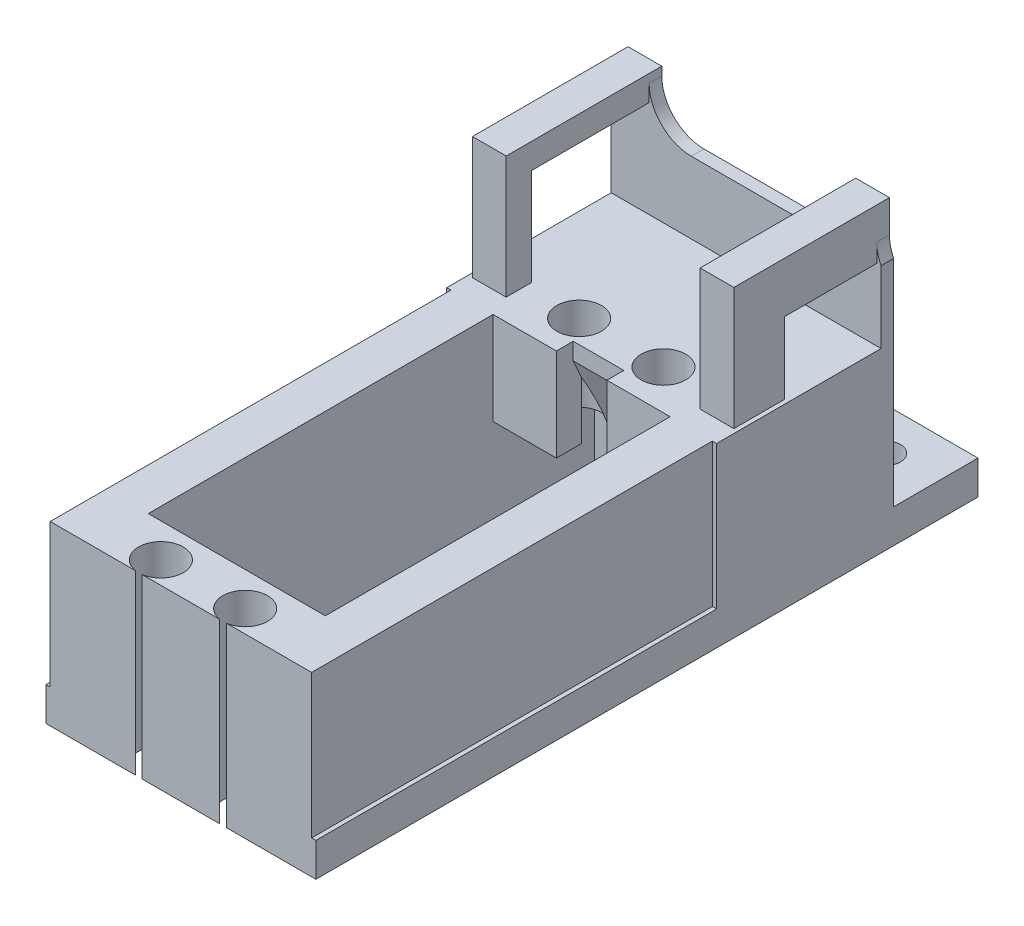
from build123d import *

# Parameters (mm, degrees)
SKETCH1_W                  = 32
SKETCH1_H                  = 78.52
BOSS_EXTRUDE1_DEPTH        = 4
M3_CLEARANCE_HOLE1_D       = 3.6
M3_CLEARANCE_HOLE1_DEPTH   = 10
M3_CLEARANCE_HOLE1_TIP     = 1.081549114
BOSS_EXTRUDE2_DEPTH        = 17
BOSS_EXTRUDE3_DEPTH        = 17
SKETCH6_W                  = 32
SKETCH6_H                  = 1.5
SKETCH6_W_2                = 4
SKETCH6_H_2                = 6
BOSS_EXTRUDE4_DEPTH        = 8.5
SKETCH14_W                 = 4
SKETCH14_H                 = 18.45
BOSS_EXTRUDE5_DEPTH        = 6
FILLET1_R                  = 5
CHAMFER1_SIZE              = 3
CHAMFER2_SIZE              = 3
CUT_EXTRUDE1_DEPTH         = 87.102499383
CUT_EXTRUDE1_DEPTH_BACK    = 87.102499383
SKETCH15_W                 = 21
SKETCH15_H                 = 40.897809358
F_5_3_5_3_DIAMETER_HOLE1_D = 5.3
SKETCH19_W                 = 21
SKETCH19_H                 = 12
CUT_EXTRUDE2_DEPTH         = 10
CUT_EXTRUDE3_DEPTH         = 83.839546112
CUT_EXTRUDE3_DEPTH_BACK    = 83.839546112
SKETCH20_W                 = 6
SKETCH20_H                 = 2
CHAMFER3_SIZE              = 8.984147096
CHAMFER3_SIZE_2            = 4


with BuildPart() as part:
    # Sketch1 → Boss-Extrude1 (new body)
    with BuildSketch(Plane(origin=(0, 0, 0), x_dir=(1, 0, 0), z_dir=(0, 1, 0))):
        with Locations((0, 39.26)):
            Rectangle(SKETCH1_W, SKETCH1_H)
    extrude(amount=BOSS_EXTRUDE1_DEPTH)

    # M3 Clearance Hole1
    with Locations(Plane(origin=(0, 4, 0), x_dir=(1, 0, 0), z_dir=(0, 1, 0))):
        with Locations((-10, 73.52), (10, 73.52)):
            Hole(M3_CLEARANCE_HOLE1_D / 2, depth=M3_CLEARANCE_HOLE1_DEPTH)
            with Locations((0, 0, -(M3_CLEARANCE_HOLE1_DEPTH + M3_CLEARANCE_HOLE1_TIP / 2))):  # 118° drill point
                Cone(0, M3_CLEARANCE_HOLE1_D / 2, M3_CLEARANCE_HOLE1_TIP, mode=Mode.SUBTRACT)

    # Sketch5 → Boss-Extrude2 (add)
    with BuildSketch(Plane(origin=(0, 4, 0), x_dir=(1, 0, 0), z_dir=(0, 1, 0))):
        Polygon((16, 68.52), (-16, 68.52), (-16, 47.520000358), (-15.5, 47.520000358), (-10.5, 47.520000358), (10.5, 47.520000358), (15.5, 47.520000358), (16, 47.520000358), align=None)
    extrude(amount=BOSS_EXTRUDE2_DEPTH)

    # Sketch5<4> → Boss-Extrude3 (add)
    with BuildSketch(Plane(origin=(0, 4, 0), x_dir=(1, 0, 0), z_dir=(0, 1, 0))):
        Polygon((-10.5, 47.520000358), (-15.5, 47.520000358), (-15.5, 0), (15.5, 0), (15.5, 47.520000358), (10.5, 47.520000358), (10.5, 6.622191), (-10.5, 6.622191), align=None)
    extrude(amount=BOSS_EXTRUDE3_DEPTH)

    # Sketch6 → Boss-Extrude4 (add)
    with BuildSketch(Plane(origin=(0, 21, 0), x_dir=(1, 0, 0), z_dir=(0, 1, 0))):
        with Locations((0, 67.77)):
            Rectangle(SKETCH6_W, SKETCH6_H)
        with Locations((13.5, 53.07)):
            Rectangle(SKETCH6_W_2, SKETCH6_H_2)
        with Locations((-13.5, 53.07)):
            Rectangle(SKETCH6_W_2, SKETCH6_H_2)
    extrude(amount=BOSS_EXTRUDE4_DEPTH)

    # Sketch14 → Boss-Extrude5 (add)
    with BuildSketch(Plane(origin=(0, 29.5, 0), x_dir=(1, 0, 0), z_dir=(0, 1, 0))):
        with Locations((-13.5, 59.295)):
            Rectangle(SKETCH14_W, SKETCH14_H)
        with Locations((13.5, 59.295)):
            Rectangle(SKETCH14_W, SKETCH14_H)
    extrude(amount=BOSS_EXTRUDE5_DEPTH)

    # Fillet1
    # the kernel refuses this fillet: 5 mm, written as the material it adds along each edge
    with BuildSketch(Plane(origin=(-11.5, 29.5, -68.52), x_dir=(0, 1, 0), z_dir=(0, 0, 1)), Plane(origin=(11.5, 29.5, -68.52), x_dir=(-1, 0, 0), z_dir=(0, 0, 1))) as fillet1_piece_1:
        with BuildLine():
            CenterArc((FILLET1_R, -FILLET1_R), FILLET1_R, 90, 90)
            Line((0, -FILLET1_R), (0, 0))
            Line((0, 0), (FILLET1_R, 0))
        make_face()
    extrude(amount=1.5)
    with BuildSketch(Plane(origin=(-15.5, 29.5, -67.02), x_dir=(-1, 0, 0), z_dir=(0, 0, -1))) as fillet1_piece_2:
        with BuildLine():
            CenterArc((5, 2.179449472), FILLET1_R, 180, 25.841932763)
            Line((0, 2.179449472), (0, 0))
            Line((0, 0), (0.5, 0))
        make_face()
    extrude(amount=1.5)
    with BuildSketch(Plane(origin=(15.5, 29.5, -67.02), x_dir=(0, 1, 0), z_dir=(0, 0, -1))) as fillet1_piece_3:
        with BuildLine():
            CenterArc((2.179449472, 5), FILLET1_R, 244.158067237, 25.841932763)
            Line((0, 0.5), (0, 0))
            Line((0, 0), (2.179449472, 0))
        make_face()
    extrude(amount=1.5)

    # Chamfer1
    chamfer1_edges = [part.edges().sort_by_distance(p)[0] for p in [
        (-11.5, 29.5, -61.545),
        (11.5, 29.5, -61.545),
    ]]
    chamfer(chamfer1_edges, length=CHAMFER1_SIZE)

    # Chamfer2
    chamfer2_edges = [part.edges().sort_by_distance(p)[0] for p in [
        (11.5, 26.75, -56.07),
        (-11.5, 26.75, -56.07),
    ]]
    chamfer(chamfer2_edges, length=CHAMFER2_SIZE)

    # Sketch15 → Cut-Extrude1 (cut, two sides: drawn at the far end of the back side and taken through both)
    with BuildSketch(Plane(origin=(0, 4, 0), x_dir=(1, 0, 0), z_dir=(0, 1, 0)).offset(-CUT_EXTRUDE1_DEPTH_BACK)):
        with Locations((0, 27.071095679)):
            Rectangle(SKETCH15_W, SKETCH15_H)
    extrude(amount=CUT_EXTRUDE1_DEPTH + CUT_EXTRUDE1_DEPTH_BACK, mode=Mode.SUBTRACT)

    # Ø5.3 (5.3) Diameter Hole1 (through all)
    with Locations(Plane(origin=(0, 21, 0), x_dir=(1, 0, 0), z_dir=(0, 1, 0))):
        with Locations((-5, 52.220000358), (5, 52.220000358), (-5, 2.62), (5, 2.62)):
            Hole(F_5_3_5_3_DIAMETER_HOLE1_D / 2)

    # Sketch19 → Cut-Extrude2 (cut)
    with BuildSketch(Plane.XZ):
        with Locations((0, -53.520000358)):
            Rectangle(SKETCH19_W, SKETCH19_H)
    extrude(amount=-CUT_EXTRUDE2_DEPTH, mode=Mode.SUBTRACT)

    # Sketch20 → Cut-Extrude3 (cut, two sides: drawn at the far end of the back side and taken through both)
    with BuildSketch(Plane(origin=(0, 21, 0), x_dir=(1, 0, 0), z_dir=(0, 1, 0)).offset(-CUT_EXTRUDE3_DEPTH_BACK)):
        with Locations((0, 48.520000358)):
            Rectangle(SKETCH20_W, SKETCH20_H)
    extrude(amount=CUT_EXTRUDE3_DEPTH + CUT_EXTRUDE3_DEPTH_BACK, mode=Mode.SUBTRACT)

    # Chamfer3
    # the kernel refuses this chamfer: 8.984147096, 4 mm, written as the material it takes off along each edge
    with BuildSketch(Plane(origin=(-3, 10, -49.520000358), x_dir=(0, 0.9998768419809391, 0.015693975602887315), z_dir=(1, 0, 0))) as chamfer3_piece_1:
        Polygon((CHAMFER3_SIZE * 0.999876841938, -CHAMFER3_SIZE * 0.0156939756022), (-CHAMFER3_SIZE_2 * 0.0156939756029, -CHAMFER3_SIZE_2 * 0.999876841981), (0, 0), align=None)
    extrude(amount=6, mode=Mode.SUBTRACT)


solid = part.part
